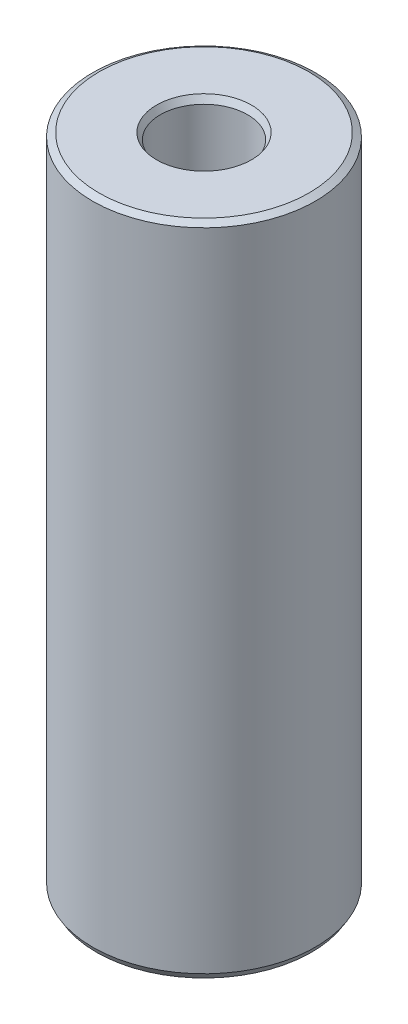
from build123d import *
from OCP.BRepFilletAPI import BRepFilletAPI_MakeChamfer

# Parameters (mm, degrees)
SKETCH1_R           = 35
BOSS_EXTRUDE1_DEPTH = 206.246052756
SKETCH2_R           = 13.708007975
CUT_EXTRUDE1_DEPTH  = 213.102414596
CHAMFER1_SIZE       = 1.214889492
CHAMFER1_SIZE2      = 2.015384609


with BuildPart() as part:
    # Sketch1 → Boss-Extrude1 (new body)
    with BuildSketch(Plane(origin=(0, 0, 0), x_dir=(1, 0, 0), z_dir=(0, 1, 0))):
        Circle(SKETCH1_R)
    extrude(amount=BOSS_EXTRUDE1_DEPTH)

    # Sketch2 → Cut-Extrude1 (cut, through all)
    with BuildSketch(Plane(origin=(0, 0, 0), x_dir=(1, 0, 0), z_dir=(0, 1, 0))):
        Circle(SKETCH2_R)
    extrude(amount=CUT_EXTRUDE1_DEPTH, mode=Mode.SUBTRACT)

    # Chamfer1: one chamfer whose edges measure the first distance from different faces: ONE call of the kernel's chamfer builder (chamfer() names one face for all edges)
    chamfer1_edges_1 = [part.edges().sort_by_distance(p)[0] for p in [
        (-13.708007975, 206.246052756, 0),
    ]]
    chamfer1_side_1 = [part.faces().sort_by_distance(p)[0] for p in [
        (-34.010050506, 206.246052756, 0),
    ]]
    chamfer1_edges_2 = [part.edges().sort_by_distance(p)[0] for p in [
        (-13.708007975, 0, 0),
    ]]
    chamfer1_side_2 = [part.faces().sort_by_distance(p)[0] for p in [
        (-13.708007975, 103.123026378, 0),
    ]]
    chamfer1_edges_3 = [part.edges().sort_by_distance(p)[0] for p in [
        (-35, 0, 0),
    ]]
    chamfer1_side_3 = [part.faces().sort_by_distance(p)[0] for p in [
        (-34.010050506, 0, 0),
    ]]
    chamfer1_edges_4 = [part.edges().sort_by_distance(p)[0] for p in [
        (-35, 206.246052756, 0),
    ]]
    chamfer1_side_4 = [part.faces().sort_by_distance(p)[0] for p in [
        (-35, 103.123026378, 0),
    ]]
    chamfer1 = BRepFilletAPI_MakeChamfer(part.part.solid().wrapped)
    for e in chamfer1_edges_1:
        chamfer1.Add(CHAMFER1_SIZE, CHAMFER1_SIZE2, e.wrapped, chamfer1_side_1[0].wrapped)  # the first distance lies on this face
    for e in chamfer1_edges_2:
        chamfer1.Add(CHAMFER1_SIZE, CHAMFER1_SIZE2, e.wrapped, chamfer1_side_2[0].wrapped)  # the first distance lies on this face
    for e in chamfer1_edges_3:
        chamfer1.Add(CHAMFER1_SIZE, CHAMFER1_SIZE2, e.wrapped, chamfer1_side_3[0].wrapped)  # the first distance lies on this face
    for e in chamfer1_edges_4:
        chamfer1.Add(CHAMFER1_SIZE, CHAMFER1_SIZE2, e.wrapped, chamfer1_side_4[0].wrapped)  # the first distance lies on this face
    add(Compound.cast(chamfer1.Shape()), mode=Mode.REPLACE)


solid = part.part
